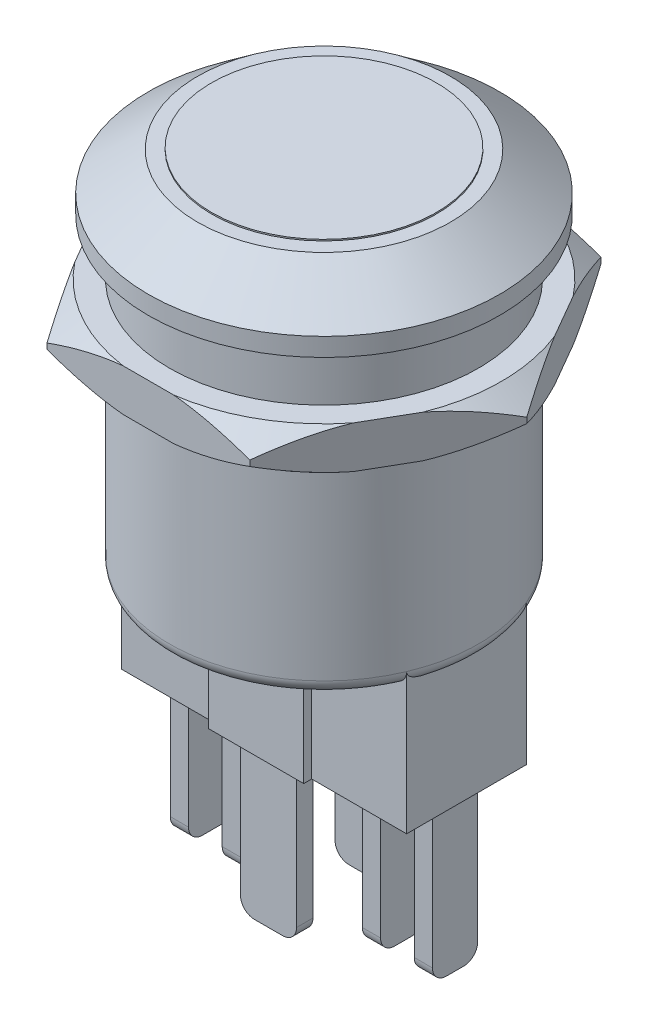
from build123d import *

# Parameters (mm, degrees)
SKETCH_1_R          = 11
EXTRUDE_1_DEPTH     = 15
EXTRUDE_5_DEPTH     = 9
EXTRUDE_START       = 9
SKETCH_2_W          = 1.293526219
SKETCH_2_H          = 3.220572058
SKETCH_2_W_2        = 1.29352622
SKETCH_2_W_3        = 3.99471459
SKETCH_2_H_2        = 1.168280376
EXTRUDE_2_DEPTH     = 11
EXTRUDE_6_DEPTH     = 3
SKETCH_10_R         = 12.5
EXTRUDE_7_DEPTH     = 8
CHAMFER_2_SIZE      = 2.7
CHAMFER_2_SIZE2     = 3.5
FILLET_2_R          = 1
FILLET_3_R          = 1
SKETCH_13_R         = 8
EXTRUDE_8_DEPTH     = 0.1
FILLET_5_R          = 1
SKETCH_15_R         = 12.5
SKETCH_15_R_2       = 11
CUT_EXTRUDE_4_DEPTH = 4


with BuildPart() as part:
    # 草图1 → 凸台-拉伸1 (new body)
    with BuildSketch(Plane(origin=(0, 0, 0), x_dir=(1, 0, 0), z_dir=(0, 1, 0))):
        with Locations(Location((0, 0, 0), (0, 0, 270))):
            Circle(SKETCH_1_R)
    extrude(amount=EXTRUDE_1_DEPTH)

    # 草图8 → 凸台-拉伸5 (add)
    with BuildSketch(Plane.XZ):
        Polygon((-3.382547232, 4.259557328), (-3.382547232, 4.825560501), (3.382547232, 4.825560501), (3.382547232, 4.259557328), (10.141803162, 4.259557328), (10.141803162, -4.259557328), (3.382547232, -4.259557328), (3.382547232, -4.825560501), (-3.382547232, -4.825560501), (-3.382547232, -4.259557328), (-10.141803162, -4.259557328), (-10.141803162, 4.259557328), align=None)
    extrude(amount=EXTRUDE_5_DEPTH)

    # 草图2 → 凸台-拉伸2 (add)
    with BuildSketch(Plane.XZ.offset(EXTRUDE_START)):
        with Locations((-4.988450059, 0)):
            Rectangle(SKETCH_2_W, SKETCH_2_H)
        with Locations((4.988450059, 0)):
            Rectangle(SKETCH_2_W, SKETCH_2_H)
        with Locations((8.683189087, 0)):
            Rectangle(SKETCH_2_W_2, SKETCH_2_H)
        with Locations((-8.683189087, 0)):
            Rectangle(SKETCH_2_W_2, SKETCH_2_H)
        with Locations((0, -3.368236223)):
            Rectangle(SKETCH_2_W_3, SKETCH_2_H_2)
        with Locations((0, 3.368236223)):
            Rectangle(SKETCH_2_W_3, SKETCH_2_H_2)
    extrude(amount=EXTRUDE_2_DEPTH)

    # 草图9 → 凸台-拉伸6 (add)
    with BuildSketch(Plane(origin=(0, 15, 0), x_dir=(1, 0, 0), z_dir=(0, 1, 0))):
        Polygon((-7.216878365, 12.5), (-14.43375673, 0), (-7.216878365, -12.5), (7.216878365, -12.5), (14.43375673, 0), (7.216878365, 12.5), align=None)
    extrude(amount=EXTRUDE_6_DEPTH)

    # 草图10 → 凸台-拉伸7 (add)
    with BuildSketch(Plane(origin=(0, 18, 0), x_dir=(1, 0, 0), z_dir=(0, 1, 0))):
        with Locations(Location((0, 0, 0), (0, 0, 270))):
            Circle(SKETCH_10_R)
    extrude(amount=EXTRUDE_7_DEPTH)

    # 倒角2
    chamfer_2_edges = [part.edges().sort_by_distance(p)[0] for p in [
        (0, 26, -12.5),
    ]]
    chamfer_2_side = [part.faces().sort_by_distance(p)[0] for p in [
        (0, 22, -12.5),
    ]]
    chamfer(chamfer_2_edges, length=CHAMFER_2_SIZE, length2=CHAMFER_2_SIZE2, reference=chamfer_2_side[0])

    # 草图12 → 切除-旋转1 (revolve, cut)
    with BuildSketch(Plane.XY, mode=Mode.PRIVATE) as cut_revolve_1_sk:
        Polygon((-12.629537139, 18), (-14.43375673, 16.7), (-14.43375673, 16.3), (-12.629537139, 15), (-12.629537139, 14.5), (-14.93375673, 14.5), (-14.93375673, 18.5), (-12.629537139, 18.5), align=None)
    revolve(cut_revolve_1_sk.sketch.rotate(Axis((0, 15, 0), (0, 1, 0)), 202.78240573), axis=Axis((0, 15, 0), (0, 1, 0)), mode=Mode.SUBTRACT)

    # 圆角2
    # the kernel refuses this fillet: 1 mm, written as the material it takes off along each edge
    with BuildSketch(Plane(origin=(0, 0, 0), x_dir=(0.9219821056073602, 0, -0.3872324843550948), z_dir=(0.3872324843550948, 0, 0.9219821056073602))) as fillet_2_piece_1_section:
        with BuildLine():
            CenterArc((11 - FILLET_2_R, FILLET_2_R), FILLET_2_R, 270, 90)
            Line((11 - FILLET_2_R, 0), (11, 0))
            Line((11, 0), (11, FILLET_2_R))
        make_face()
    fillet_2_piece_1 = revolve(axis=Axis((0, 0, 0), (0, 1, 0)), revolution_arc=134.435188539, mode=Mode.PRIVATE)
    fillet_2_piece_1 = split(fillet_2_piece_1, bisect_by=Plane(origin=(0, 0.280498427, -4.259557328), z_dir=(0, 0, -1)), keep=Keep.TOP, mode=Mode.PRIVATE)
    add(fillet_2_piece_1, mode=Mode.SUBTRACT)
    with BuildSketch(Plane(origin=(0, 0, 0), x_dir=(0, 0, 1), z_dir=(-1, 0, 0))) as fillet_2_piece_2_section:
        with BuildLine():
            CenterArc((11 - FILLET_2_R, FILLET_2_R), FILLET_2_R, 270, 90)
            Line((11 - FILLET_2_R, 0), (11, 0))
            Line((11, 0), (11, FILLET_2_R))
        make_face()
    fillet_2_piece_2 = revolve(axis=Axis((0, 0, 0), (0, 1, 0)), revolution_arc=67.21759427, mode=Mode.PRIVATE)
    fillet_2_piece_2 = split(fillet_2_piece_2, bisect_by=Plane(origin=(5.932037011, 0.283055472, 4.259557328), z_dir=(0, 0, 1)), keep=Keep.TOP, mode=Mode.PRIVATE)
    add(fillet_2_piece_2, mode=Mode.SUBTRACT)
    with BuildSketch(Plane(origin=(0, 0, 0), x_dir=(-0.9219821056073602, 0, 0.38723248435509466), z_dir=(-0.38723248435509466, 0, -0.9219821056073602))) as fillet_2_piece_3_section:
        with BuildLine():
            CenterArc((11 - FILLET_2_R, FILLET_2_R), FILLET_2_R, 270, 90)
            Line((11 - FILLET_2_R, 0), (11, 0))
            Line((11, 0), (11, FILLET_2_R))
        make_face()
    fillet_2_piece_3 = revolve(axis=Axis((0, 0, 0), (0, 1, 0)), revolution_arc=67.21759427, mode=Mode.PRIVATE)
    fillet_2_piece_3 = split(fillet_2_piece_3, bisect_by=Plane(origin=(-5.93203701, 0.283055475, 4.259557328), z_dir=(0, 0, 1)), keep=Keep.TOP, mode=Mode.PRIVATE)
    add(fillet_2_piece_3, mode=Mode.SUBTRACT)

    # 圆角3
    # the kernel refuses this fillet: 1 mm, written as the material it takes off along each edge
    with BuildSketch(Plane(origin=(0, 0, 0), x_dir=(0.811007517406604, 0, 0.5850357311395405), z_dir=(-0.5850357311395405, 0, 0.811007517406604))) as fillet_3_piece_1_section:
        with BuildLine():
            CenterArc((11 - FILLET_3_R, FILLET_3_R), FILLET_3_R, 270, 90)
            Line((11 - FILLET_3_R, 0), (11, 0))
            Line((11, 0), (11, FILLET_3_R))
        make_face()
    fillet_3_piece_1 = revolve(axis=Axis((0, 0, 0), (0, 1, 0)), revolution_arc=71.611028585, mode=Mode.PRIVATE)
    fillet_3_piece_1 = split(fillet_3_piece_1, bisect_by=Plane(origin=(9.365381882, 0.233729185, 4.259557328), z_dir=(0, 0, 1)), keep=Keep.TOP, mode=Mode.PRIVATE)
    fillet_3_piece_1 = split(fillet_3_piece_1, bisect_by=Plane(origin=(10.141803162, 0.233729185, 5.307217675), z_dir=(-1, 0, 0)), keep=Keep.TOP, mode=Mode.PRIVATE)
    add(fillet_3_piece_1, mode=Mode.SUBTRACT)
    with BuildSketch(Plane(origin=(0, 0, 0), x_dir=(0.811007517406604, 0, 0.5850357311395405), z_dir=(-0.5850357311395405, 0, 0.811007517406604))) as fillet_3_piece_2_section:
        with BuildLine():
            CenterArc((11 - FILLET_3_R, FILLET_3_R), FILLET_3_R, 270, 90)
            Line((11 - FILLET_3_R, 0), (11, 0))
            Line((11, 0), (11, FILLET_3_R))
        make_face()
    fillet_3_piece_2 = revolve(axis=Axis((0, 0, 0), (0, 1, 0)), revolution_arc=71.611028585, mode=Mode.PRIVATE)
    fillet_3_piece_2 = split(fillet_3_piece_2, bisect_by=Plane(origin=(9.365382131, 0.233729175, -4.259557328), z_dir=(0, 0, -1)), keep=Keep.TOP, mode=Mode.PRIVATE)
    fillet_3_piece_2 = split(fillet_3_piece_2, bisect_by=Plane(origin=(10.141803162, 0.233729175, -5.307217523), z_dir=(-1, 0, 0)), keep=Keep.TOP, mode=Mode.PRIVATE)
    add(fillet_3_piece_2, mode=Mode.SUBTRACT)
    with BuildSketch(Plane(origin=(0, 0, 0), x_dir=(0.811007517406604, 0, 0.5850357311395405), z_dir=(-0.5850357311395405, 0, 0.811007517406604))) as fillet_3_piece_3_section:
        with BuildLine():
            CenterArc((11 - FILLET_3_R, FILLET_3_R), FILLET_3_R, 270, 90)
            Line((11 - FILLET_3_R, 0), (11, 0))
            Line((11, 0), (11, FILLET_3_R))
        make_face()
    fillet_3_piece_3 = revolve(axis=Axis((0, 0, 0), (0, 1, 0)), revolution_arc=71.611028585, mode=Mode.PRIVATE)
    fillet_3_piece_3 = split(fillet_3_piece_3, bisect_by=Plane(origin=(10.764842796, 0.336885819, 4.259557328), z_dir=(0, 0, -1)), keep=Keep.TOP, mode=Mode.PRIVATE)
    fillet_3_piece_3 = split(fillet_3_piece_3, bisect_by=Plane(origin=(10.764842796, 0.336885819, -4.259557328), z_dir=(0, 0, 1)), keep=Keep.TOP, mode=Mode.PRIVATE)
    fillet_3_piece_3 = split(fillet_3_piece_3, bisect_by=Plane(origin=(10.141803162, 0.336885819, 0), z_dir=(1, 0, 0)), keep=Keep.TOP, mode=Mode.PRIVATE)
    add(fillet_3_piece_3, mode=Mode.SUBTRACT)
    with BuildSketch(Plane(origin=(0, 0, 0), x_dir=(-0.8110075174066043, 0, -0.5850357311395403), z_dir=(0.5850357311395403, 0, -0.8110075174066043))) as fillet_3_piece_4_section:
        with BuildLine():
            CenterArc((11 - FILLET_3_R, FILLET_3_R), FILLET_3_R, 270, 90)
            Line((11 - FILLET_3_R, 0), (11, 0))
            Line((11, 0), (11, FILLET_3_R))
        make_face()
    fillet_3_piece_4 = revolve(axis=Axis((0, 0, 0), (0, 1, 0)), revolution_arc=71.611028585, mode=Mode.PRIVATE)
    fillet_3_piece_4 = split(fillet_3_piece_4, bisect_by=Plane(origin=(-9.365381882, 0.233729185, -4.259557328), z_dir=(0, 0, -1)), keep=Keep.TOP, mode=Mode.PRIVATE)
    fillet_3_piece_4 = split(fillet_3_piece_4, bisect_by=Plane(origin=(-10.141803162, 0.233729185, -5.307217675), z_dir=(1, 0, 0)), keep=Keep.TOP, mode=Mode.PRIVATE)
    add(fillet_3_piece_4, mode=Mode.SUBTRACT)
    with BuildSketch(Plane(origin=(0, 0, 0), x_dir=(-0.8110075174066043, 0, -0.5850357311395403), z_dir=(0.5850357311395403, 0, -0.8110075174066043))) as fillet_3_piece_5_section:
        with BuildLine():
            CenterArc((11 - FILLET_3_R, FILLET_3_R), FILLET_3_R, 270, 90)
            Line((11 - FILLET_3_R, 0), (11, 0))
            Line((11, 0), (11, FILLET_3_R))
        make_face()
    fillet_3_piece_5 = revolve(axis=Axis((0, 0, 0), (0, 1, 0)), revolution_arc=71.611028585, mode=Mode.PRIVATE)
    fillet_3_piece_5 = split(fillet_3_piece_5, bisect_by=Plane(origin=(-9.365382131, 0.233729175, 4.259557328), z_dir=(0, 0, 1)), keep=Keep.TOP, mode=Mode.PRIVATE)
    fillet_3_piece_5 = split(fillet_3_piece_5, bisect_by=Plane(origin=(-10.141803162, 0.233729175, 5.307217523), z_dir=(1, 0, 0)), keep=Keep.TOP, mode=Mode.PRIVATE)
    add(fillet_3_piece_5, mode=Mode.SUBTRACT)
    with BuildSketch(Plane(origin=(0, 0, 0), x_dir=(-0.8110075174066043, 0, -0.5850357311395403), z_dir=(0.5850357311395403, 0, -0.8110075174066043))) as fillet_3_piece_6_section:
        with BuildLine():
            CenterArc((11 - FILLET_3_R, FILLET_3_R), FILLET_3_R, 270, 90)
            Line((11 - FILLET_3_R, 0), (11, 0))
            Line((11, 0), (11, FILLET_3_R))
        make_face()
    fillet_3_piece_6 = revolve(axis=Axis((0, 0, 0), (0, 1, 0)), revolution_arc=71.611028585, mode=Mode.PRIVATE)
    fillet_3_piece_6 = split(fillet_3_piece_6, bisect_by=Plane(origin=(-10.764842796, 0.336885819, 4.259557328), z_dir=(0, 0, -1)), keep=Keep.TOP, mode=Mode.PRIVATE)
    fillet_3_piece_6 = split(fillet_3_piece_6, bisect_by=Plane(origin=(-10.764842796, 0.336885819, -4.259557328), z_dir=(0, 0, 1)), keep=Keep.TOP, mode=Mode.PRIVATE)
    fillet_3_piece_6 = split(fillet_3_piece_6, bisect_by=Plane(origin=(-10.141803162, 0.336885819, 0), z_dir=(-1, 0, 0)), keep=Keep.TOP, mode=Mode.PRIVATE)
    add(fillet_3_piece_6, mode=Mode.SUBTRACT)

    # 草图13 → 凸台-拉伸8 (add)
    with BuildSketch(Plane(origin=(0, 26, 0), x_dir=(1, 0, 0), z_dir=(0, 1, 0))):
        with Locations(Location((0, 0, 0), (0, 0, 270))):
            Circle(SKETCH_13_R)
    extrude(amount=EXTRUDE_8_DEPTH)

    # 圆角5
    fillet_5_edges = [part.edges().sort_by_distance(p)[0] for p in [
        (4.98845006, -20, 1.610286029),
        (4.98845006, -20, -1.610286029),
        (-4.98845006, -20, 1.610286029),
        (-4.98845006, -20, -1.610286029),
        (8.683189087, -20, 1.610286029),
        (8.683189087, -20, -1.610286029),
        (-8.683189087, -20, 1.610286029),
        (-8.683189087, -20, -1.610286029),
        (-1.997357295, -20, 3.368236223),
        (1.997357295, -20, 3.368236223),
        (-1.997357295, -20, -3.368236223),
        (1.997357295, -20, -3.368236223),
    ]]
    fillet(fillet_5_edges, radius=FILLET_5_R)

    # 草图15 → 切除-拉伸4 (cut)
    with BuildSketch(Plane(origin=(0, 18, 0), x_dir=(1, 0, 0), z_dir=(0, 1, 0))):
        with Locations(Location((0, 0, 0), (0, 0, 270))):
            Circle(SKETCH_15_R)
        with Locations(Location((0, 0, 0), (0, 0, 22.78240573))):
            Circle(SKETCH_15_R_2, mode=Mode.SUBTRACT)
    extrude(amount=CUT_EXTRUDE_4_DEPTH, mode=Mode.SUBTRACT)


solid = part.part
